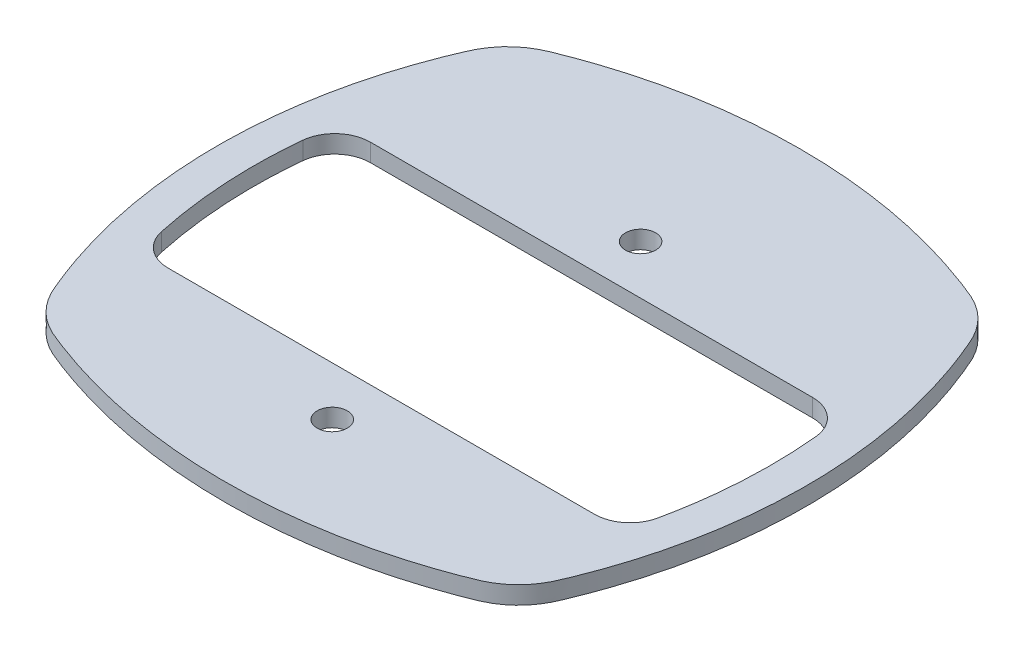
from build123d import *

# Parameters (mm, degrees)
BOSS_EXTRUDE1_OUTLINE_R = 2.15
BOSS_EXTRUDE1_DEPTH     = 2.54
FILLET1_R               = 5.08


# Read off the part's stored shape, not the designer's step: Boss-Extrude1
with BuildPart() as part:
    # Boss-Extrude1 outline → Boss-Extrude1 (new body)
    with BuildSketch(Plane(origin=(0, 0, 0), x_dir=(1, 0, 0), z_dir=(0, 1, 0))):
        with BuildLine():
            add(Edge.make_bspline(
                [(63.5, 25.779135007), (63.701010114, 25.779134997), (64.103839633, 25.77762668), (64.709270915, 25.77081735), (65.317050689, 25.759402044), (65.92711311, 25.743326073), (66.539388043, 25.72253458), (67.153804424, 25.696972536), (67.770289339, 25.666584736), (68.38876825, 25.631315806), (69.009164913, 25.591110192), (69.631401385, 25.545912205), (70.25539799, 25.495665857), (70.881073359, 25.440315462), (71.508344241, 25.379803402), (72.137126308, 25.314079129), (72.767335382, 25.243109029), (73.398885438, 25.166857055), (74.031688764, 25.085288205), (74.665655858, 24.998367601), (75.300695433, 24.906060737), (75.936714396, 24.808333427), (76.573617834, 24.705151813), (77.211309, 24.596482399), (77.849689283, 24.482291942), (78.48865827, 24.362547888), (79.128113946, 24.237216654), (79.767954877, 24.106269703), (80.40808362, 23.969698509), (81.048401856, 23.827492626), (81.688809804, 23.679643083), (82.329205906, 23.526141577), (82.969486859, 23.366980706), (83.609547588, 23.202153918), (84.249281229, 23.031655525), (84.888579141, 22.855480776), (85.527330801, 22.673625588), (86.165424283, 22.486087565), (86.802747071, 22.292861407), (87.439193759, 22.093959287), (88.074663999, 21.889403109), (88.709056793, 21.679213528), (89.342269673, 21.463412792), (89.974199272, 21.242025725), (90.604738204, 21.015073498), (91.233786901, 20.782597667), (91.861209282, 20.544570234), (92.486998305, 20.301229742), (93.111103563, 20.051647655), (93.737701486, 19.797607538), (94.354742003, 19.504001185), (94.962149432, 19.171161121), (95.554827164, 18.795891366), (96.127600486, 18.37834772), (96.710973488, 17.891114051), (97.292638095, 17.325745954), (97.858208661, 16.676986326), (98.371410535, 15.983682347), (98.826349004, 15.252681255), (99.224712429, 14.49301835), (99.565486434, 13.705999933), (99.903165468, 12.912073766), (100.234061721, 12.103873325), (100.559507848, 11.281466054), (100.878698634, 10.444633654), (101.191319634, 9.593432624), (101.496907747, 8.727855394), (101.795026787, 7.847923605), (102.085213883, 6.953663485), (102.367011778, 6.045124195), (102.639992926, 5.122384218), (102.903712014, 4.185536614), (103.157716243, 3.234682334), (103.551257165, 1.677565978), (104.062541415, -0.593335836), (104.628518028, -3.690608601), (105.097982042, -7.116113599), (105.426791973, -10.866874975), (105.558319436, -14.630094696), (105.501283615, -18.290609994), (105.30076338, -21.535081337), (104.991036815, -24.507285251), (104.616380311, -27.152304857), (104.179915994, -29.617292235), (103.771359201, -31.55599058), (103.426177357, -33.025044837), (103.161965196, -34.0796626), (102.887189582, -35.112837331), (102.602654648, -36.12452003), (102.309140242, -37.114682347), (102.007395713, -38.083321503), (101.698164333, -39.030468503), (101.382214655, -39.956199337), (101.060263125, -40.860602271), (100.733054339, -41.743808754), (100.401113372, -42.605870168), (100.065638465, -43.447196566), (99.725026249, -44.267557446), (99.385113392, -45.075249816), (98.989151232, -45.849660765), (98.537819828, -46.589175266), (98.031100972, -47.285433955), (97.493661672, -47.91179368), (96.934590975, -48.468992305), (96.362819851, -48.960430427), (95.76394183, -49.405976059), (95.143791737, -49.803511778), (94.508565694, -50.152951429), (93.864096195, -50.457861118), (93.211256514, -50.719706932), (92.563055206, -50.977187815), (91.914474843, -51.227015864), (91.265840211, -51.470568972), (90.61715964, -51.707536604), (89.968626362, -51.938019966), (89.320379967, -52.162013475), (88.672570062, -52.379542945), (88.025339388, -52.590628763), (87.378828295, -52.795295375), (86.733174091, -52.993569631), (86.088512452, -53.18547684), (85.444985159, -53.371061666), (84.802736321, -53.550377679), (84.161907179, -53.72347715), (83.522635228, -53.8904141), (82.885055219, -54.051243595), (82.249294925, -54.206021797), (80.674589635, -54.575681539), (78.159365826, -55.096205167), (74.701052001, -55.653371201), (71.271746825, -56.054776382), (67.885568395, -56.305833484), (64.251273157, -56.425274194), (60.322925316, -56.37477618), (56.062397119, -56.100233), (51.740856879, -55.588814027), (48.537958674, -55.031091745), (46.459612837, -54.595822981), (45.505974731, -54.383856188), (44.548522032, -54.158583978), (43.587658253, -53.919839074), (42.623811659, -53.667459737), (41.657424971, -53.401289156), (40.688956516, -53.121178653), (39.718876087, -52.826972891), (38.747634588, -52.518594351), (37.775685591, -52.195979817), (36.803473162, -51.859109672), (35.831539037, -51.507829952), (34.860129257, -51.142546925), (33.889516047, -50.761159768), (32.909843703, -50.366956686), (31.953600026, -49.87165853), (31.099558275, -49.318329169), (30.34996482, -48.726767024), (29.700807093, -48.119828479), (29.098874781, -47.448709523), (28.550966779, -46.722524754), (28.065445765, -45.948648428), (27.642383034, -45.137289059), (27.284204146, -44.290396185), (26.927841967, -43.431463493), (26.57760468, -42.552032033), (26.232173884, -41.652041267), (25.892664619, -40.731145835), (25.559645545, -39.789320333), (25.23386857, -38.826471597), (24.916068414, -37.842547857), (24.607023755, -36.837515123), (24.307470846, -35.811392144), (24.018168087, -34.764222803), (23.606038209, -33.182255075), (23.02826614, -30.706342877), (22.325047242, -26.958245903), (21.701122167, -22.080122261), (21.410501068, -16.707252697), (21.521732006, -11.420389465), (21.924976567, -6.795295148), (22.519653975, -2.747816905), (23.097376226, 0.140546289), (23.547981194, 2.067254506), (23.838269264, 3.223055286), (24.142924421, 4.358238329), (24.461119868, 5.472629031), (24.792050087, 6.566070854), (25.134942906, 7.63843597), (25.489007414, 8.689643446), (25.853433585, 9.719657176), (26.227395886, 10.728493144), (26.610291322, 11.716079033), (27.000812577, 12.682756619), (27.400731642, 13.628379472), (27.804492145, 14.563390146), (28.28870155, 15.458360902), (28.85239762, 16.308323107), (29.44906147, 17.044639239), (30.054127818, 17.672984088), (30.648885885, 18.201520782), (31.27611404, 18.680775807), (31.928962669, 19.108198382), (32.600530661, 19.482856508), (33.284034566, 19.808407305), (33.977895985, 20.087340493), (34.667675153, 20.362308712), (35.359084887, 20.629001608), (36.051660913, 20.889053072), (36.745424744, 21.142040728), (37.440169126, 21.388054163), (38.135751756, 21.627049379), (38.832016726, 21.859021341), (39.528815567, 22.083957527), (40.226001168, 22.301851404), (40.923428395, 22.512693883), (41.620945088, 22.716493306), (42.318392033, 22.913277754), (43.015612058, 23.103072138), (43.712451301, 23.285903875), (44.408758213, 23.461801827), (45.104388979, 23.630795645), (46.75651851, 24.01630248), (49.369092943, 24.549616309), (52.946561719, 25.10897729), (56.500541656, 25.500400924), (60.015699434, 25.729033803), (62.345264073, 25.779135065), (63.5, 25.779135007)],
                knots=[0, 0, 0, 0, 0.002167362, 0.004343533, 0.006528399, 0.008721844, 0.010923749, 0.013133994, 0.015352454, 0.017579002, 0.019813509, 0.022055845, 0.024305873, 0.02656346, 0.028828465, 0.031100747, 0.033380165, 0.035666572, 0.037959816, 0.040259743, 0.042566196, 0.044879012, 0.047198024, 0.049523065, 0.05185396, 0.054190533, 0.056532604, 0.058879994, 0.061232534, 0.063590048, 0.065952359, 0.068319283, 0.07069063, 0.073066207, 0.075445815, 0.07782925, 0.080216304, 0.082606761, 0.085000407, 0.087397042, 0.089796478, 0.092198521, 0.094602971, 0.09700962, 0.099418257, 0.101828662, 0.104240609, 0.106653867, 0.109068198, 0.111488535, 0.113942665, 0.116431482, 0.118952505, 0.121501134, 0.124068727, 0.12714211, 0.130237098, 0.13333892, 0.136432672, 0.139512041, 0.142578264, 0.145676731, 0.148815407, 0.151994264, 0.155213267, 0.158472371, 0.16177152, 0.165110653, 0.168489699, 0.17190856, 0.175367083, 0.178865095, 0.182402411, 0.185978829, 0.196182266, 0.207494454, 0.219918148, 0.233449374, 0.248075013, 0.260498867, 0.272910186, 0.283112332, 0.292712698, 0.301708585, 0.310099564, 0.314072048, 0.317979573, 0.321821972, 0.32559911, 0.329310887, 0.332957236, 0.33653815, 0.340053696, 0.343503961, 0.346889054, 0.350209103, 0.353464256, 0.356654683, 0.359787503, 0.362909739, 0.36602299, 0.369119789, 0.372184607, 0.374912315, 0.377622944, 0.380306945, 0.382954267, 0.385559244, 0.388119136, 0.39063634, 0.393141874, 0.395639963, 0.398130279, 0.400612506, 0.403086337, 0.405551476, 0.408007636, 0.41045454, 0.412891919, 0.415319518, 0.417737083, 0.420144349, 0.422541041, 0.424926892, 0.427301646, 0.429665051, 0.432016867, 0.434356858, 0.447105835, 0.459701281, 0.472115409, 0.484323242, 0.496302162, 0.511313064, 0.526665405, 0.542315357, 0.558213231, 0.561699772, 0.565211089, 0.568746464, 0.572305145, 0.575886342, 0.579489226, 0.58311293, 0.58675656, 0.590419274, 0.594100228, 0.597798532, 0.601513252, 0.605243407, 0.608987966, 0.612759276, 0.616623238, 0.620579453, 0.623713116, 0.626908088, 0.630149784, 0.6334216, 0.636704742, 0.639989506, 0.643275894, 0.646615321, 0.650017332, 0.653482036, 0.657009523, 0.660599858, 0.66425309, 0.667969246, 0.671748323, 0.675590233, 0.679494838, 0.683461963, 0.693216629, 0.7069023, 0.724563155, 0.74620604, 0.764853934, 0.781536624, 0.796232349, 0.808942487, 0.813283937, 0.817567006, 0.82179135, 0.825956651, 0.830062623, 0.834109017, 0.838095661, 0.842022461, 0.845889346, 0.849696263, 0.853443178, 0.85713008, 0.860767948, 0.86441936, 0.868085325, 0.871749994, 0.874621699, 0.877482234, 0.880320803, 0.88312556, 0.885888591, 0.888606558, 0.891282493, 0.893950166, 0.896613682, 0.899272698, 0.90192688, 0.904575904, 0.907219459, 0.909857243, 0.912488966, 0.915114348, 0.917733118, 0.92034499, 0.922949661, 0.925546832, 0.928136216, 0.930717533, 0.933290511, 0.935854889, 0.949010093, 0.962029554, 0.97488454, 0.987549227, 1, 1, 1, 1], degree=3))
        make_face()
        with Locations((63.499995584, -41.05)):
            Circle(BOSS_EXTRUDE1_OUTLINE_R, mode=Mode.SUBTRACT)
        with BuildLine():
            Line((27.484668104, -4.050002575), (99.515317732, -4.050003461))
            add(Edge.make_bspline(
                [(99.515317732, -4.050003461), (99.570627448, -4.382894659), (99.741462564, -5.459962052), (100.246480989, -9.21710889), (100.607964216, -15.371924844), (100.21746052, -22.12597742), (99.436548713, -27.474905919), (98.743831379, -30.837777019), (98.191173486, -33.019479619), (97.953269585, -33.88738893), (97.908057032, -34.05)],
                knots=[0.206127593, 0.206127593, 0.206127593, 0.206127593, 0.210033843, 0.21875, 0.25, 0.28125, 0.296875, 0.3125, 0.320960571, 0.322913696, 0.322913696, 0.322913696, 0.322913696], degree=3))
            Line((97.908057032, -34.05), (29.091934136, -34.05))
            add(Edge.make_bspline(
                [(29.091934136, -34.05), (29.046721942, -33.88738933), (28.809223004, -33.020952155), (28.256871022, -30.840748756), (27.564281066, -27.479230025), (26.782926914, -22.129609966), (26.392003265, -15.374509753), (26.773197438, -8.880754437), (27.305839007, -5.126164292), (27.484668104, -4.050002575)],
                knots=[0.677103964, 0.677103964, 0.677103964, 0.677103964, 0.679057089, 0.6875, 0.703125, 0.71875, 0.75, 0.78125, 0.793879521, 0.793879521, 0.793879521, 0.793879521], degree=3))
        make_face(mode=Mode.SUBTRACT)
        with Locations((63.499995584, 2.95)):
            Circle(BOSS_EXTRUDE1_OUTLINE_R, mode=Mode.SUBTRACT)
    extrude(amount=BOSS_EXTRUDE1_DEPTH)

    # Fillet1
    fillet1_edges = [part.edges().sort_by_distance(p)[0] for p in [
        (99.515317732, 1.27, 4.050003461),
        (27.484668104, 1.27, 4.050002575),
        (29.091934136, 1.27, 34.05),
        (97.908057032, 1.27, 34.05),
    ]]
    fillet(fillet1_edges, radius=FILLET1_R)


solid = part.part
